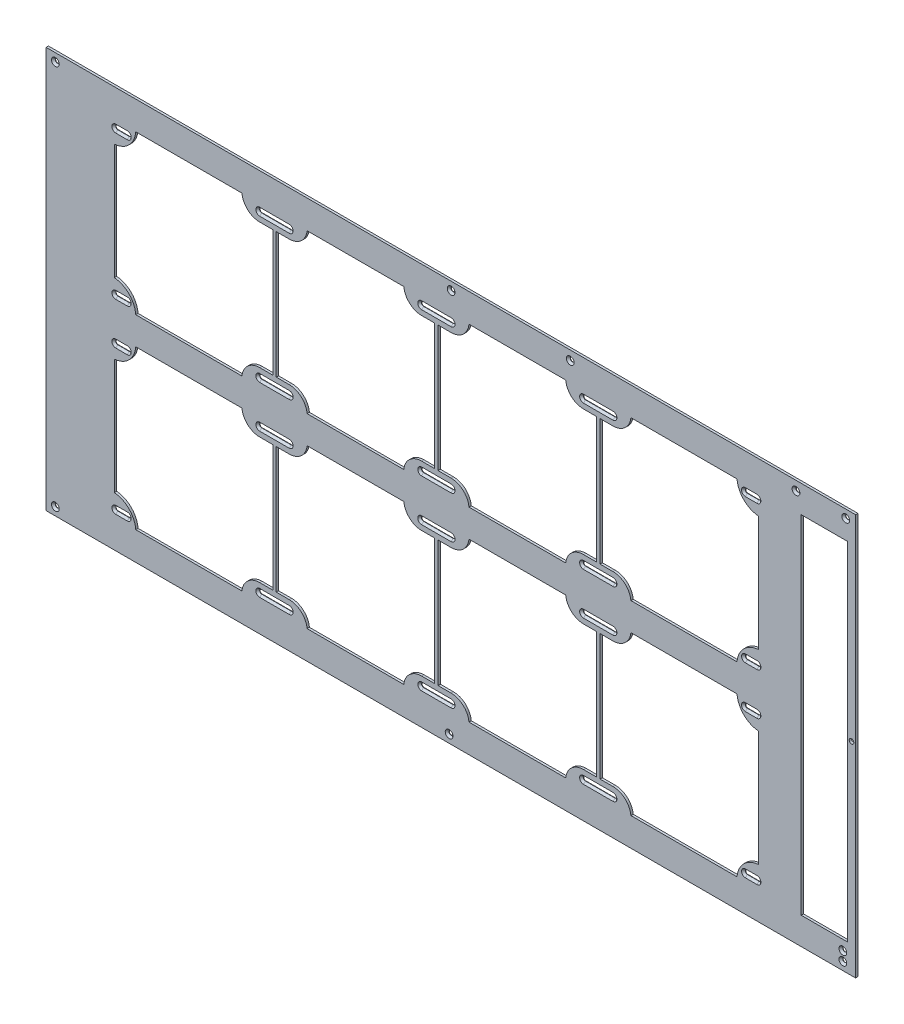
from build123d import *

# Parameters (mm, degrees)
SKETCH1_W                                    = 700
SKETCH1_H                                    = 347
SKETCH1_R                                    = 2
SKETCH1_W_2                                  = 40
SKETCH1_H_2                                  = 300
BASE_FLANGE1_DEPTH                           = 2
CSK_FOR_M3_HEX_SOCKET_COUNTERSUNK_CA_2_COUNT = 2
CSK_FOR_M3_HEX_SOCKET_COUNTERSUNK_CA_2_PITCH = 342.25
CSK_FOR_M3_HEX_SOCKET_COUNTERSUNK_CA_3_COUNT = 2
CSK_FOR_M3_HEX_SOCKET_COUNTERSUNK_CA_3_PITCH = 445.301013361
CSK_FOR_M3_HEX_SOCKET_COUNTERSUNK_CA_4_COUNT = 2
CSK_FOR_M3_HEX_SOCKET_COUNTERSUNK_CA_4_PITCH = 640.500704527
CSK_FOR_M3_HEX_SOCKET_COUNTERSUNK_CA_5_COUNT = 2
CSK_FOR_M3_HEX_SOCKET_COUNTERSUNK_CA_5_PITCH = 683.5
CSK_FOR_M3_HEX_SOCKET_COUNTERSUNK_CA_6_COUNT = 2
CSK_FOR_M3_HEX_SOCKET_COUNTERSUNK_CA_6_PITCH = 754.576702529
CSK_FOR_M3_HEX_SOCKET_COUNTERSUNK_CA_7_COUNT = 2
CSK_FOR_M3_HEX_SOCKET_COUNTERSUNK_CA_7_PITCH = 758.05672611
CSK_FOR_M3_HEX_SOCKET_COUNTERSUNK_CA_8_COUNT = 2
CSK_FOR_M3_HEX_SOCKET_COUNTERSUNK_CA_8_PITCH = 476.265944615
CSK_FOR_M3_HEX_SOCKET_COUNTERSUNK_CA_9_COUNT = 2
CSK_FOR_M3_HEX_SOCKET_COUNTERSUNK_CA_9_PITCH = 333
CUT_EXTRUDE1_DEPTH                           = 782.289319011
CHAMFER1_SIZE                                = 1.66


# Read off the part's stored shape, not the designer's step: top.step
# Sheet-metal steps are written as plain solids
with BuildPart() as part:
    # Base-Flange1: sheet metal written as solids
    # Sketch1 → Base-Flange1 (new body)
    with BuildSketch(Plane.XY):
        with Locations((350, 173.5)):
            Rectangle(SKETCH1_W, SKETCH1_H)
        with Locations((696.5, 175.5)):
            Circle(SKETCH1_R, mode=Mode.SUBTRACT)
        with BuildLine():
            Line((490.25, 147.5), (479, 147.5))
            Line((479, 147.5), (479, 93))
            Line((479, 93), (479, 38.5))
            Line((479, 38.5), (490.25, 38.5))
            ThreePointArc((490.25, 38.5), (500.666333328, 34.478240283), (505.67724862, 24.5))
            Line((505.67724862, 24.5), (547.5, 24.5))
            Line((547.5, 24.5), (597.5, 24.5))
            ThreePointArc((597.5, 24.5), (603.318145396, 37.181854604), (616, 43))
            Line((616, 43), (616, 143))
            ThreePointArc((616, 143), (603.318145396, 148.818145396), (597.5, 161.5))
            Line((597.5, 161.5), (547.5, 161.5))
            Line((547.5, 161.5), (505.67724862, 161.5))
            ThreePointArc((505.67724862, 161.5), (500.666333328, 151.521759717), (490.25, 147.5))
        make_face(mode=Mode.SUBTRACT)
        with BuildLine():
            Line((476, 147.5), (464.75, 147.5))
            ThreePointArc((464.75, 147.5), (454.333666672, 151.521759717), (449.32275138, 161.5))
            Line((449.32275138, 161.5), (407.5, 161.5))
            Line((407.5, 161.5), (365.67724862, 161.5))
            ThreePointArc((365.67724862, 161.5), (360.666333328, 151.521759717), (350.25, 147.5))
            Line((350.25, 147.5), (339, 147.5))
            Line((339, 147.5), (339, 93))
            Line((339, 93), (339, 38.5))
            Line((339, 38.5), (350.25, 38.5))
            ThreePointArc((350.25, 38.5), (360.666333328, 34.478240283), (365.67724862, 24.5))
            Line((365.67724862, 24.5), (407.5, 24.5))
            Line((407.5, 24.5), (449.32275138, 24.5))
            ThreePointArc((449.32275138, 24.5), (454.333666672, 34.478240283), (464.75, 38.5))
            Line((464.75, 38.5), (476, 38.5))
            Line((476, 38.5), (476, 93))
            Line((476, 93), (476, 147.5))
        make_face(mode=Mode.SUBTRACT)
        with BuildLine():
            Line((336, 147.5), (324.75, 147.5))
            ThreePointArc((324.75, 147.5), (314.333666672, 151.521759717), (309.32275138, 161.5))
            Line((309.32275138, 161.5), (267.5, 161.5))
            Line((267.5, 161.5), (225.67724862, 161.5))
            ThreePointArc((225.67724862, 161.5), (220.666333328, 151.521759717), (210.25, 147.5))
            Line((210.25, 147.5), (199, 147.5))
            Line((199, 147.5), (199, 93))
            Line((199, 93), (199, 38.5))
            Line((199, 38.5), (210.25, 38.5))
            ThreePointArc((210.25, 38.5), (220.666333328, 34.478240283), (225.677248621, 24.5))
            Line((225.677248621, 24.5), (267.5, 24.5))
            Line((267.5, 24.5), (309.32275138, 24.5))
            ThreePointArc((309.32275138, 24.5), (314.333666672, 34.478240283), (324.75, 38.5))
            Line((324.75, 38.5), (336, 38.5))
            Line((336, 38.5), (336, 93))
            Line((336, 93), (336, 147.5))
        make_face(mode=Mode.SUBTRACT)
        with BuildLine():
            Line((196, 147.5), (184.75, 147.5))
            ThreePointArc((184.75, 147.5), (174.333666672, 151.521759717), (169.322751379, 161.5))
            Line((169.322751379, 161.5), (127.5, 161.5))
            Line((127.5, 161.5), (77.5, 161.5))
            ThreePointArc((77.5, 161.5), (71.681854604, 148.818145396), (59, 143))
            Line((59, 143), (59, 43))
            ThreePointArc((59, 43), (71.681854604, 37.181854604), (77.5, 24.5))
            Line((77.5, 24.5), (127.5, 24.5))
            Line((127.5, 24.5), (169.32275138, 24.5))
            ThreePointArc((169.32275138, 24.5), (174.333666672, 34.478240283), (184.75, 38.5))
            Line((184.75, 38.5), (196, 38.5))
            Line((196, 38.5), (196, 93))
            Line((196, 93), (196, 147.5))
        make_face(mode=Mode.SUBTRACT)
        with BuildLine():
            Line((490.25, 308.5), (479, 308.5))
            Line((479, 308.5), (479, 254))
            Line((479, 254), (479, 199.5))
            Line((479, 199.5), (490.25, 199.5))
            ThreePointArc((490.25, 199.5), (500.666333328, 195.478240283), (505.67724862, 185.5))
            Line((505.67724862, 185.5), (547.5, 185.5))
            Line((547.5, 185.5), (597.5, 185.5))
            ThreePointArc((597.5, 185.5), (603.318145396, 198.181854604), (616, 204))
            Line((616, 204), (616, 304))
            ThreePointArc((616, 304), (603.318145396, 309.818145396), (597.5, 322.5))
            Line((597.5, 322.5), (547.5, 322.5))
            Line((547.5, 322.5), (505.67724862, 322.5))
            ThreePointArc((505.67724862, 322.5), (500.666333328, 312.521759717), (490.25, 308.5))
        make_face(mode=Mode.SUBTRACT)
        with BuildLine():
            Line((476, 308.5), (464.75, 308.5))
            ThreePointArc((464.75, 308.5), (454.333666672, 312.521759717), (449.32275138, 322.5))
            Line((449.32275138, 322.5), (407.5, 322.5))
            Line((407.5, 322.5), (365.67724862, 322.5))
            ThreePointArc((365.67724862, 322.5), (360.666333328, 312.521759717), (350.25, 308.5))
            Line((350.25, 308.5), (339, 308.5))
            Line((339, 308.5), (339, 254))
            Line((339, 254), (339, 199.5))
            Line((339, 199.5), (350.25, 199.5))
            ThreePointArc((350.25, 199.5), (360.666333328, 195.478240283), (365.67724862, 185.5))
            Line((365.67724862, 185.5), (407.5, 185.5))
            Line((407.5, 185.5), (449.32275138, 185.5))
            ThreePointArc((449.32275138, 185.5), (454.333666672, 195.478240283), (464.75, 199.5))
            Line((464.75, 199.5), (476, 199.5))
            Line((476, 199.5), (476, 254))
            Line((476, 254), (476, 308.5))
        make_face(mode=Mode.SUBTRACT)
        with BuildLine():
            Line((336, 308.5), (324.75, 308.5))
            ThreePointArc((324.75, 308.5), (314.333666672, 312.521759717), (309.32275138, 322.5))
            Line((309.32275138, 322.5), (267.5, 322.5))
            Line((267.5, 322.5), (225.67724862, 322.5))
            ThreePointArc((225.67724862, 322.5), (220.666333328, 312.521759717), (210.25, 308.5))
            Line((210.25, 308.5), (199, 308.5))
            Line((199, 308.5), (199, 254))
            Line((199, 254), (199, 199.5))
            Line((199, 199.5), (210.25, 199.5))
            ThreePointArc((210.25, 199.5), (220.666333328, 195.478240283), (225.677248621, 185.5))
            Line((225.677248621, 185.5), (267.5, 185.5))
            Line((267.5, 185.5), (309.32275138, 185.5))
            ThreePointArc((309.32275138, 185.5), (314.333666672, 195.478240283), (324.75, 199.5))
            Line((324.75, 199.5), (336, 199.5))
            Line((336, 199.5), (336, 254))
            Line((336, 254), (336, 308.5))
        make_face(mode=Mode.SUBTRACT)
        with BuildLine():
            Line((196, 308.5), (184.75, 308.5))
            ThreePointArc((184.75, 308.5), (174.333666672, 312.521759717), (169.322751379, 322.5))
            Line((169.322751379, 322.5), (127.5, 322.5))
            Line((127.5, 322.5), (77.5, 322.5))
            ThreePointArc((77.5, 322.5), (71.681854604, 309.818145396), (59, 304))
            Line((59, 304), (59, 204))
            ThreePointArc((59, 204), (71.681854604, 198.181854604), (77.5, 185.5))
            Line((77.5, 185.5), (127.5, 185.5))
            Line((127.5, 185.5), (169.32275138, 185.5))
            ThreePointArc((169.32275138, 185.5), (174.333666672, 195.478240283), (184.75, 199.5))
            Line((184.75, 199.5), (196, 199.5))
            Line((196, 199.5), (196, 254))
            Line((196, 254), (196, 308.5))
        make_face(mode=Mode.SUBTRACT)
        with Locations((673, 173.5)):
            Rectangle(SKETCH1_W_2, SKETCH1_H_2, mode=Mode.SUBTRACT)
    extrude(amount=-BASE_FLANGE1_DEPTH)

    # Sketch4 → CSK for M3 Hex Socket Countersunk Cap Screw1 (revolve, cut)
    with BuildSketch(Plane(origin=(8, 340, 0), x_dir=(0, -1, 0), z_dir=(1, 0, 0))):
        Polygon((0, 0), (0, 2), (1.7, 2), (1.7, 1.66), (3.36, 0), align=None)
    csk_for_m3_hex_socket_countersunk_cap_sc = revolve(axis=Axis((8, 340, 6.35), (0, 0, -1)), mode=Mode.SUBTRACT)

    # CSK for M3 Hex Socket Countersunk Ca 2: CSK for M3 Hex Socket Countersunk Cap Screw1 ×2
    with Locations(*[(i * CSK_FOR_M3_HEX_SOCKET_COUNTERSUNK_CA_2_PITCH, 0, 0) for i in range(1, CSK_FOR_M3_HEX_SOCKET_COUNTERSUNK_CA_2_COUNT)]):
        add(csk_for_m3_hex_socket_countersunk_cap_sc, mode=Mode.SUBTRACT)

    # CSK for M3 Hex Socket Countersunk Ca 3: CSK for M3 Hex Socket Countersunk Cap Screw1 ×2
    with Locations(*[Vector(0.9999977243244567, -0.00213338836314432, 0) * (i * CSK_FOR_M3_HEX_SOCKET_COUNTERSUNK_CA_3_PITCH) for i in range(1, CSK_FOR_M3_HEX_SOCKET_COUNTERSUNK_CA_3_COUNT)]):
        add(csk_for_m3_hex_socket_countersunk_cap_sc, mode=Mode.SUBTRACT)

    # CSK for M3 Hex Socket Countersunk Ca 4: CSK for M3 Hex Socket Countersunk Cap Screw1 ×2
    with Locations(*[Vector(0.9999989000366116, -0.0014832146058309334, 0) * (i * CSK_FOR_M3_HEX_SOCKET_COUNTERSUNK_CA_4_PITCH) for i in range(1, CSK_FOR_M3_HEX_SOCKET_COUNTERSUNK_CA_4_COUNT)]):
        add(csk_for_m3_hex_socket_countersunk_cap_sc, mode=Mode.SUBTRACT)

    # CSK for M3 Hex Socket Countersunk Ca 5: CSK for M3 Hex Socket Countersunk Cap Screw1 ×2
    with Locations(*[(i * CSK_FOR_M3_HEX_SOCKET_COUNTERSUNK_CA_5_PITCH, 0, 0) for i in range(1, CSK_FOR_M3_HEX_SOCKET_COUNTERSUNK_CA_5_COUNT)]):
        add(csk_for_m3_hex_socket_countersunk_cap_sc, mode=Mode.SUBTRACT)

    # CSK for M3 Hex Socket Countersunk Ca 6: CSK for M3 Hex Socket Countersunk Cap Screw1 ×2
    with Locations(*[Vector(0.9024927455582981, -0.4307050547818602, 0) * (i * CSK_FOR_M3_HEX_SOCKET_COUNTERSUNK_CA_6_PITCH) for i in range(1, CSK_FOR_M3_HEX_SOCKET_COUNTERSUNK_CA_6_COUNT)]):
        add(csk_for_m3_hex_socket_countersunk_cap_sc, mode=Mode.SUBTRACT)

    # CSK for M3 Hex Socket Countersunk Ca 7: CSK for M3 Hex Socket Countersunk Cap Screw1 ×2
    with Locations(*[Vector(0.8983496571489348, -0.43928110988339975, 0) * (i * CSK_FOR_M3_HEX_SOCKET_COUNTERSUNK_CA_7_PITCH) for i in range(1, CSK_FOR_M3_HEX_SOCKET_COUNTERSUNK_CA_7_COUNT)]):
        add(csk_for_m3_hex_socket_countersunk_cap_sc, mode=Mode.SUBTRACT)

    # CSK for M3 Hex Socket Countersunk Ca 8: CSK for M3 Hex Socket Countersunk Cap Screw1 ×2
    with Locations(*[Vector(0.7149366941935442, -0.6991891899161532, 0) * (i * CSK_FOR_M3_HEX_SOCKET_COUNTERSUNK_CA_8_PITCH) for i in range(1, CSK_FOR_M3_HEX_SOCKET_COUNTERSUNK_CA_8_COUNT)]):
        add(csk_for_m3_hex_socket_countersunk_cap_sc, mode=Mode.SUBTRACT)

    # CSK for M3 Hex Socket Countersunk Ca 9: CSK for M3 Hex Socket Countersunk Cap Screw1 ×2
    with Locations(*[(0, -i * CSK_FOR_M3_HEX_SOCKET_COUNTERSUNK_CA_9_PITCH, 0) for i in range(1, CSK_FOR_M3_HEX_SOCKET_COUNTERSUNK_CA_9_COUNT)]):
        add(csk_for_m3_hex_socket_countersunk_cap_sc, mode=Mode.SUBTRACT)

    # Sketch5 → Cut-Extrude1 (cut, through all)
    with BuildSketch(Plane.XY):
        with BuildLine():
            Line((60.25, 317.95), (70.25, 317.95))
            ThreePointArc((70.25, 317.95), (71.95, 316.25), (70.25, 314.55))
            Line((70.25, 314.55), (60.25, 314.55))
            ThreePointArc((60.25, 314.55), (58.55, 316.25), (60.25, 317.95))
        make_face()
        with BuildLine():
            Line((60.25, 193.45), (70.25, 193.45))
            ThreePointArc((70.25, 193.45), (71.95, 191.75), (70.25, 190.05))
            Line((70.25, 190.05), (60.25, 190.05))
            ThreePointArc((60.25, 190.05), (58.55, 191.75), (60.25, 193.45))
        make_face()
        with BuildLine():
            Line((60.25, 156.95), (70.25, 156.95))
            ThreePointArc((70.25, 156.95), (71.95, 155.25), (70.25, 153.55))
            Line((70.25, 153.55), (60.25, 153.55))
            ThreePointArc((60.25, 153.55), (58.55, 155.25), (60.25, 156.95))
        make_face()
        with BuildLine():
            Line((60.25, 32.45), (70.25, 32.45))
            ThreePointArc((70.25, 32.45), (71.95, 30.75), (70.25, 29.05))
            Line((70.25, 29.05), (60.25, 29.05))
            ThreePointArc((60.25, 29.05), (58.55, 30.75), (60.25, 32.45))
        make_face()
        with BuildLine():
            Line((604.75, 317.95), (614.75, 317.95))
            ThreePointArc((614.75, 317.95), (616.45, 316.25), (614.75, 314.55))
            Line((614.75, 314.55), (604.75, 314.55))
            ThreePointArc((604.75, 314.55), (603.05, 316.25), (604.75, 317.95))
        make_face()
        with BuildLine():
            Line((604.75, 193.45), (614.75, 193.45))
            ThreePointArc((614.75, 193.45), (616.45, 191.75), (614.75, 190.05))
            Line((614.75, 190.05), (604.75, 190.05))
            ThreePointArc((604.75, 190.05), (603.05, 191.75), (604.75, 193.45))
        make_face()
        with BuildLine():
            Line((604.75, 156.95), (614.75, 156.95))
            ThreePointArc((614.75, 156.95), (616.45, 155.25), (614.75, 153.55))
            Line((614.75, 153.55), (604.75, 153.55))
            ThreePointArc((604.75, 153.55), (603.05, 155.25), (604.75, 156.95))
        make_face()
        with BuildLine():
            Line((604.75, 32.45), (614.75, 32.45))
            ThreePointArc((614.75, 32.45), (616.45, 30.75), (614.75, 29.05))
            Line((614.75, 29.05), (604.75, 29.05))
            ThreePointArc((604.75, 29.05), (603.05, 30.75), (604.75, 32.45))
        make_face()
        with BuildLine():
            Line((184.75, 317.95), (210.25, 317.95))
            ThreePointArc((210.25, 317.95), (211.95, 316.25), (210.25, 314.55))
            Line((210.25, 314.55), (184.75, 314.55))
            ThreePointArc((184.75, 314.55), (183.05, 316.25), (184.75, 317.95))
        make_face()
        with BuildLine():
            Line((324.75, 317.95), (350.25, 317.95))
            ThreePointArc((350.25, 317.95), (351.95, 316.25), (350.25, 314.55))
            Line((350.25, 314.55), (324.75, 314.55))
            ThreePointArc((324.75, 314.55), (323.05, 316.25), (324.75, 317.95))
        make_face()
        with BuildLine():
            Line((464.75, 317.95), (490.25, 317.95))
            ThreePointArc((490.25, 317.95), (491.95, 316.25), (490.25, 314.55))
            Line((490.25, 314.55), (464.75, 314.55))
            ThreePointArc((464.75, 314.55), (463.05, 316.25), (464.75, 317.95))
        make_face()
        with BuildLine():
            Line((464.75, 193.45), (490.25, 193.45))
            ThreePointArc((490.25, 193.45), (491.95, 191.75), (490.25, 190.05))
            Line((490.25, 190.05), (464.75, 190.05))
            ThreePointArc((464.75, 190.05), (463.05, 191.75), (464.75, 193.45))
        make_face()
        with BuildLine():
            Line((464.75, 156.95), (490.25, 156.95))
            ThreePointArc((490.25, 156.95), (491.95, 155.25), (490.25, 153.55))
            Line((490.25, 153.55), (464.75, 153.55))
            ThreePointArc((464.75, 153.55), (463.05, 155.25), (464.75, 156.95))
        make_face()
        with BuildLine():
            Line((324.75, 193.45), (350.25, 193.45))
            ThreePointArc((350.25, 193.45), (351.95, 191.75), (350.25, 190.05))
            Line((350.25, 190.05), (324.75, 190.05))
            ThreePointArc((324.75, 190.05), (323.05, 191.75), (324.75, 193.45))
        make_face()
        with BuildLine():
            Line((324.75, 156.95), (350.25, 156.95))
            ThreePointArc((350.25, 156.95), (351.95, 155.25), (350.25, 153.55))
            Line((350.25, 153.55), (324.75, 153.55))
            ThreePointArc((324.75, 153.55), (323.05, 155.25), (324.75, 156.95))
        make_face()
        with BuildLine():
            Line((184.75, 193.45), (210.25, 193.45))
            ThreePointArc((210.25, 193.45), (211.95, 191.75), (210.25, 190.05))
            Line((210.25, 190.05), (184.75, 190.05))
            ThreePointArc((184.75, 190.05), (183.05, 191.75), (184.75, 193.45))
        make_face()
        with BuildLine():
            Line((184.75, 156.95), (210.25, 156.95))
            ThreePointArc((210.25, 156.95), (211.95, 155.25), (210.25, 153.55))
            Line((210.25, 153.55), (184.75, 153.55))
            ThreePointArc((184.75, 153.55), (183.05, 155.25), (184.75, 156.95))
        make_face()
        with BuildLine():
            Line((184.75, 32.45), (210.25, 32.45))
            ThreePointArc((210.25, 32.45), (211.95, 30.75), (210.25, 29.05))
            Line((210.25, 29.05), (184.75, 29.05))
            ThreePointArc((184.75, 29.05), (183.05, 30.75), (184.75, 32.45))
        make_face()
        with BuildLine():
            Line((324.75, 32.45), (350.25, 32.45))
            ThreePointArc((350.25, 32.45), (351.95, 30.75), (350.25, 29.05))
            Line((350.25, 29.05), (324.75, 29.05))
            ThreePointArc((324.75, 29.05), (323.05, 30.75), (324.75, 32.45))
        make_face()
        with BuildLine():
            Line((464.75, 32.45), (490.25, 32.45))
            ThreePointArc((490.25, 32.45), (491.95, 30.75), (490.25, 29.05))
            Line((490.25, 29.05), (464.75, 29.05))
            ThreePointArc((464.75, 29.05), (463.05, 30.75), (464.75, 32.45))
        make_face()
    extrude(amount=-CUT_EXTRUDE1_DEPTH, mode=Mode.SUBTRACT)

    # Chamfer1
    chamfer1_edges = [part.edges().sort_by_distance(p)[0] for p in [
        (323.05, 316.25, 0),
        (337.5, 314.55, 0),
        (351.95, 316.25, 0),
        (337.5, 317.95, 0),
        (463.05, 316.25, 0),
        (477.5, 314.55, 0),
        (491.95, 316.25, 0),
        (477.5, 317.95, 0),
        (463.05, 191.75, 0),
        (477.5, 190.05, 0),
        (491.95, 191.75, 0),
        (477.5, 193.45, 0),
        (463.05, 155.25, 0),
        (477.5, 153.55, 0),
        (491.95, 155.25, 0),
        (477.5, 156.95, 0),
        (323.05, 191.75, 0),
        (337.5, 190.05, 0),
        (351.95, 191.75, 0),
        (337.5, 193.45, 0),
        (323.05, 155.25, 0),
        (337.5, 153.55, 0),
        (351.95, 155.25, 0),
        (337.5, 156.95, 0),
        (183.05, 191.75, 0),
        (197.5, 190.05, 0),
        (211.95, 191.75, 0),
        (197.5, 193.45, 0),
        (183.05, 155.25, 0),
        (197.5, 153.55, 0),
        (211.95, 155.25, 0),
        (197.5, 156.95, 0),
        (603.05, 316.25, 0),
        (609.75, 314.55, 0),
        (616.45, 316.25, 0),
        (609.75, 317.95, 0),
        (58.55, 30.75, 0),
        (65.25, 29.05, 0),
        (71.95, 30.75, 0),
        (65.25, 32.45, 0),
        (58.55, 155.25, 0),
        (65.25, 153.55, 0),
        (71.95, 155.25, 0),
        (65.25, 156.95, 0),
        (58.55, 191.75, 0),
        (65.25, 190.05, 0),
        (71.95, 191.75, 0),
        (65.25, 193.45, 0),
        (183.05, 316.25, 0),
        (197.5, 314.55, 0),
        (211.95, 316.25, 0),
        (197.5, 317.95, 0),
        (603.05, 30.75, 0),
        (609.75, 29.05, 0),
        (616.45, 30.75, 0),
        (609.75, 32.45, 0),
        (603.05, 155.25, 0),
        (609.75, 153.55, 0),
        (616.45, 155.25, 0),
        (609.75, 156.95, 0),
        (603.05, 191.75, 0),
        (609.75, 190.05, 0),
        (616.45, 191.75, 0),
        (609.75, 193.45, 0),
        (183.05, 30.75, 0),
        (197.5, 29.05, 0),
        (211.95, 30.75, 0),
        (197.5, 32.45, 0),
        (323.05, 30.75, 0),
        (337.5, 29.05, 0),
        (351.95, 30.75, 0),
        (337.5, 32.45, 0),
        (463.05, 30.75, 0),
        (477.5, 29.05, 0),
        (491.95, 30.75, 0),
        (477.5, 32.45, 0),
        (58.55, 316.25, 0),
        (65.25, 314.55, 0),
        (71.95, 316.25, 0),
        (65.25, 317.95, 0),
    ]]
    chamfer(chamfer1_edges, length=CHAMFER1_SIZE)


solid = part.part
